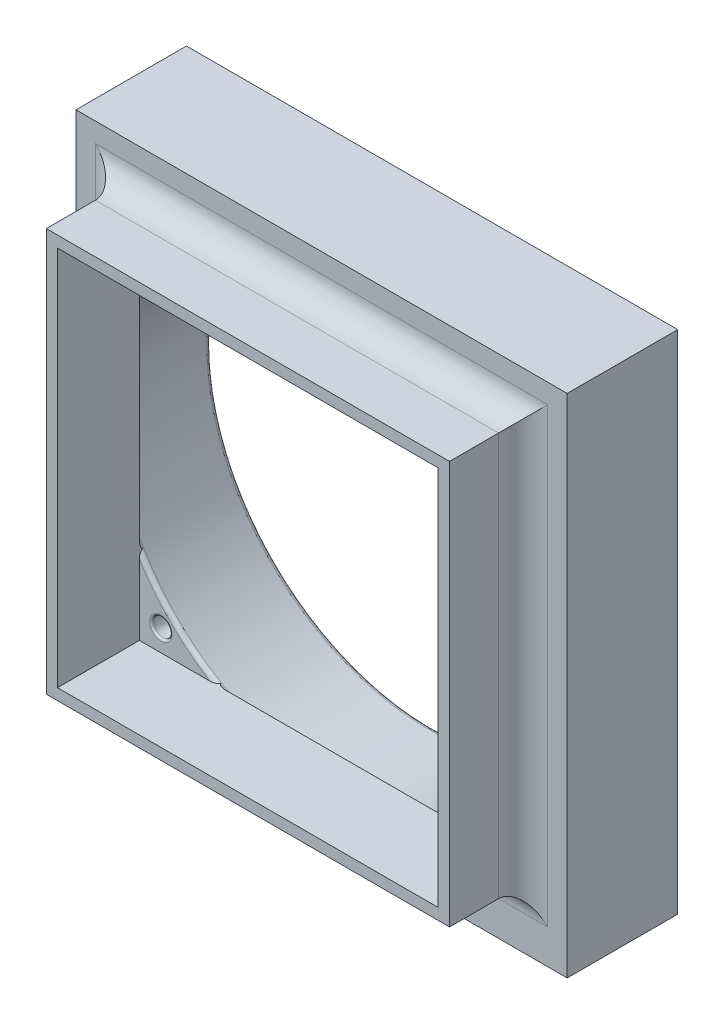
from build123d import *

# Parameters (mm, degrees)
SKIZZE1_W                       = 98.5
SKIZZE1_H                       = 98.5
SKIZZE1_W_2                     = 90.5
SKIZZE1_H_2                     = 90.5
AUFSATZ_LINEAR_AUSTRAGEN2_DEPTH = 20
SKIZZE11_W                      = 93
SKIZZE11_H                      = 93
SCHNITT_LINEAR_AUSTRAGEN2_DEPTH = 15
SKIZZE12_W                      = 120
SKIZZE12_H                      = 123.668448402
SKIZZE12_R                      = 54
AUFSATZ_LINEAR_AUSTRAGEN6_DEPTH = 25
SKIZZE15_W                      = 120
SKIZZE15_H                      = 123.668448402
SKIZZE15_W_2                    = 98.5
SKIZZE15_H_2                    = 98.5
AUFSATZ_LINEAR_AUSTRAGEN8_DEPTH = 2
SKIZZE16_W                      = 93
SKIZZE16_H                      = 93
SCHNITT_LINEAR_AUSTRAGEN3_DEPTH = 5
SKIZZE17_R                      = 2.25
SCHNITT_LINEAR_AUSTRAGEN4_DEPTH = 6
VERRUNDUNG1_R                   = 0.5
VERRUNDUNG3_R                   = 1
VERRUNDUNG5_R                   = 1
VERRUNDUNG7_R                   = 1
VERRUNDUNG8_R                   = 6


with BuildPart() as part:
    # Skizze1 → Aufsatz-Linear austragen2 (new body)
    # profile 1 of 5: a face of its own
    with BuildSketch(Plane.XY):
        Rectangle(SKIZZE1_W, SKIZZE1_H)
        Rectangle(SKIZZE1_W_2, SKIZZE1_H_2, mode=Mode.SUBTRACT)
    # profile 2 of 5: a face of its own
    with BuildSketch(Plane.XY):
        with BuildLine():
            Line((-45.25, 45.25), (-45.25, 21.270578271))
            ThreePointArc((-45.25, 21.270578271), (-35.355339059, 35.355339059), (-21.270578271, 45.25))
            Line((-21.270578271, 45.25), (-45.25, 45.25))
        make_face()
    # profile 3 of 5: a face of its own
    with BuildSketch(Plane.XY):
        with BuildLine():
            ThreePointArc((21.270578271, 45.25), (35.355339059, 35.355339059), (45.25, 21.270578271))
            Line((45.25, 21.270578271), (45.25, 45.25))
            Line((45.25, 45.25), (21.270578271, 45.25))
        make_face()
    # profile 4 of 5: a face of its own
    with BuildSketch(Plane.XY):
        with BuildLine():
            ThreePointArc((45.25, -21.270578271), (35.355339059, -35.355339059), (21.270578271, -45.25))
            Line((21.270578271, -45.25), (45.25, -45.25))
            Line((45.25, -45.25), (45.25, -21.270578271))
        make_face()
    # profile 5 of 5: a face of its own
    with BuildSketch(Plane.XY):
        with BuildLine():
            Line((-45.25, -21.270578271), (-45.25, -45.25))
            Line((-45.25, -45.25), (-21.270578271, -45.25))
            ThreePointArc((-21.270578271, -45.25), (-35.355339059, -35.355339059), (-45.25, -21.270578271))
        make_face()
    extrude(amount=AUFSATZ_LINEAR_AUSTRAGEN2_DEPTH)

    # Skizze11 → Schnitt-Linear austragen2 (cut)
    with BuildSketch(Plane.XY.offset(20)):
        Rectangle(SKIZZE11_W, SKIZZE11_H)
    extrude(amount=-SCHNITT_LINEAR_AUSTRAGEN2_DEPTH, mode=Mode.SUBTRACT)

    # Skizze12 → Aufsatz-Linear austragen6 (add)
    with BuildSketch(Plane(origin=(0, 0, 0), x_dir=(-1, 0, 0), z_dir=(0, 0, -1))):
        with Locations((0, -1.834224201)):
            Rectangle(SKIZZE12_W, SKIZZE12_H)
        with Locations(Location((0, 0, 0), (0, 0, 155.788390477))):
            Circle(SKIZZE12_R, mode=Mode.SUBTRACT)
    extrude(amount=AUFSATZ_LINEAR_AUSTRAGEN6_DEPTH)

    # Skizze15 → Aufsatz-Linear austragen8 (add)
    with BuildSketch(Plane.XY):
        with Locations((0, -1.834224201)):
            Rectangle(SKIZZE15_W, SKIZZE15_H)
        Rectangle(SKIZZE15_W_2, SKIZZE15_H_2, mode=Mode.SUBTRACT)
    extrude(amount=AUFSATZ_LINEAR_AUSTRAGEN8_DEPTH)

    # Skizze16 → Schnitt-Linear austragen3 (cut)
    with BuildSketch(Plane.XY.offset(5)):
        Rectangle(SKIZZE16_W, SKIZZE16_H)
    extrude(amount=-SCHNITT_LINEAR_AUSTRAGEN3_DEPTH, mode=Mode.SUBTRACT)

    # Skizze17 → Schnitt-Linear austragen4 (cut)
    with BuildSketch(Plane.XY):
        with Locations((41.25, -41.25)):
            Circle(SKIZZE17_R)
        with Locations((-41.25, -41.25)):
            Circle(SKIZZE17_R)
        with Locations((-41.25, 41.25)):
            Circle(SKIZZE17_R)
        with Locations((41.25, 41.25)):
            Circle(SKIZZE17_R)
    extrude(amount=-SCHNITT_LINEAR_AUSTRAGEN4_DEPTH, mode=Mode.SUBTRACT)

    # Verrundung1
    verrundung1_edges = [part.edges().sort_by_distance(p)[0] for p in [
        (39, 41.25, 0),
        (-43.5, 41.25, 0),
        (-43.5, -41.25, 0),
        (39, -41.25, 0),
    ]]
    fillet(verrundung1_edges, radius=VERRUNDUNG1_R)

    # Verrundung3
    # the kernel refuses this fillet: 1 mm, written as the material it adds along each edge
    with BuildSketch(Plane(origin=(0, 0, 0), x_dir=(0.5477312417776574, 0.8366543412788254, 0), z_dir=(0.8366543412788254, -0.5477312417776574, 0))) as verrundung3_piece_1_section:
        with BuildLine():
            CenterArc((54 - VERRUNDUNG3_R, -VERRUNDUNG3_R), VERRUNDUNG3_R, 0, 90)
            Line((54 - VERRUNDUNG3_R, 0), (54, 0))
            Line((54, 0), (54, -VERRUNDUNG3_R))
        make_face()
    verrundung3_piece_1 = revolve(axis=Axis((0, 0, 0), (0, 0, 1)), revolution_arc=66.423010951, mode=Mode.PRIVATE)
    verrundung3_piece_1 = split(verrundung3_piece_1, bisect_by=Plane(origin=(0, 46.5, -0.276639056), z_dir=(0, 1, 0)), keep=Keep.TOP, mode=Mode.PRIVATE)
    add(verrundung3_piece_1)
    with BuildSketch(Plane(origin=(0, 0, 0), x_dir=(0.8366552662090209, -0.5477298289528446, 0), z_dir=(-0.5477298289528446, -0.8366552662090209, 0))) as verrundung3_piece_2_section:
        with BuildLine():
            CenterArc((54 - VERRUNDUNG3_R, -VERRUNDUNG3_R), VERRUNDUNG3_R, 0, 90)
            Line((54 - VERRUNDUNG3_R, 0), (54, 0))
            Line((54, 0), (54, -VERRUNDUNG3_R))
        make_face()
    verrundung3_piece_2 = revolve(axis=Axis((0, 0, 0), (0, 0, 1)), revolution_arc=57.423018245, mode=Mode.PRIVATE)
    verrundung3_piece_2 = split(verrundung3_piece_2, bisect_by=Plane(origin=(46.5, -2.973995803, -0.277191271), z_dir=(1, 0, 0)), keep=Keep.TOP, mode=Mode.PRIVATE)
    add(verrundung3_piece_2)
    with BuildSketch(Plane(origin=(0, 0, 0), x_dir=(-0.5477312417775408, -0.8366543412789017, 0), z_dir=(-0.8366543412789017, 0.5477312417775408, 0))) as verrundung3_piece_3_section:
        with BuildLine():
            CenterArc((54 - VERRUNDUNG3_R, -VERRUNDUNG3_R), VERRUNDUNG3_R, 0, 90)
            Line((54 - VERRUNDUNG3_R, 0), (54, 0))
            Line((54, 0), (54, -VERRUNDUNG3_R))
        make_face()
    verrundung3_piece_3 = revolve(axis=Axis((0, 0, 0), (0, 0, 1)), revolution_arc=66.423010951, mode=Mode.PRIVATE)
    verrundung3_piece_3 = split(verrundung3_piece_3, bisect_by=Plane(origin=(0, -46.5, -0.276639056), z_dir=(0, -1, 0)), keep=Keep.TOP, mode=Mode.PRIVATE)
    add(verrundung3_piece_3)
    with BuildSketch(Plane(origin=(0, 0, 0), x_dir=(-0.8366543412788674, 0.5477312417775932, 0), z_dir=(0.5477312417775932, 0.8366543412788674, 0))) as verrundung3_piece_4_section:
        with BuildLine():
            CenterArc((54 - VERRUNDUNG3_R, -VERRUNDUNG3_R), VERRUNDUNG3_R, 0, 90)
            Line((54 - VERRUNDUNG3_R, 0), (54, 0))
            Line((54, 0), (54, -VERRUNDUNG3_R))
        make_face()
    verrundung3_piece_4 = revolve(axis=Axis((0, 0, 0), (0, 0, 1)), revolution_arc=66.423010951, mode=Mode.PRIVATE)
    verrundung3_piece_4 = split(verrundung3_piece_4, bisect_by=Plane(origin=(-46.5, 0, -0.276639056), z_dir=(-1, 0, 0)), keep=Keep.TOP, mode=Mode.PRIVATE)
    add(verrundung3_piece_4)
    with BuildSketch(Plane(origin=(0, 0, 0), x_dir=(0.9120370370393823, 0.41010784321739613, 0), z_dir=(0.41010784321739613, -0.9120370370393823, 0))) as verrundung3_piece_5_section:
        with BuildLine():
            CenterArc((54 - VERRUNDUNG3_R, -VERRUNDUNG3_R), VERRUNDUNG3_R, 0, 90)
            Line((54 - VERRUNDUNG3_R, 0), (54, 0))
            Line((54, 0), (54, -VERRUNDUNG3_R))
        make_face()
    verrundung3_piece_5 = revolve(axis=Axis((0, 0, 0), (0, 0, 1)), revolution_arc=8.999409945, mode=Mode.PRIVATE)
    verrundung3_piece_5 = split(verrundung3_piece_5, bisect_by=Plane(origin=(46.5, 24.568591389, -0.23016125), z_dir=(1, 0, 0)), keep=Keep.TOP, mode=Mode.PRIVATE)
    add(verrundung3_piece_5)

    # Verrundung5
    verrundung5_edges = [part.edges().sort_by_distance(p)[0] for p in [
        (-49.25, -22.145823534, -25),
    ]]
    fillet(verrundung5_edges, radius=VERRUNDUNG5_R)

    # Verrundung7
    verrundung7_edges = [part.edges().sort_by_distance(p)[0] for p in [
        (-38.183766184, -38.183766184, 0),
        (38.183766184, -38.183766184, 0),
        (38.183766184, 38.183766184, 0),
        (-38.183766184, 38.183766184, 0),
    ]]
    fillet(verrundung7_edges, radius=VERRUNDUNG7_R)

    # Verrundung8
    verrundung8_edges = [part.edges().sort_by_distance(p)[0] for p in [
        (49.25, 0, 2),
        (0, 49.25, 2),
        (-49.25, 0, 2),
        (0, -49.25, 2),
    ]]
    fillet(verrundung8_edges, radius=VERRUNDUNG8_R)


solid = part.part
